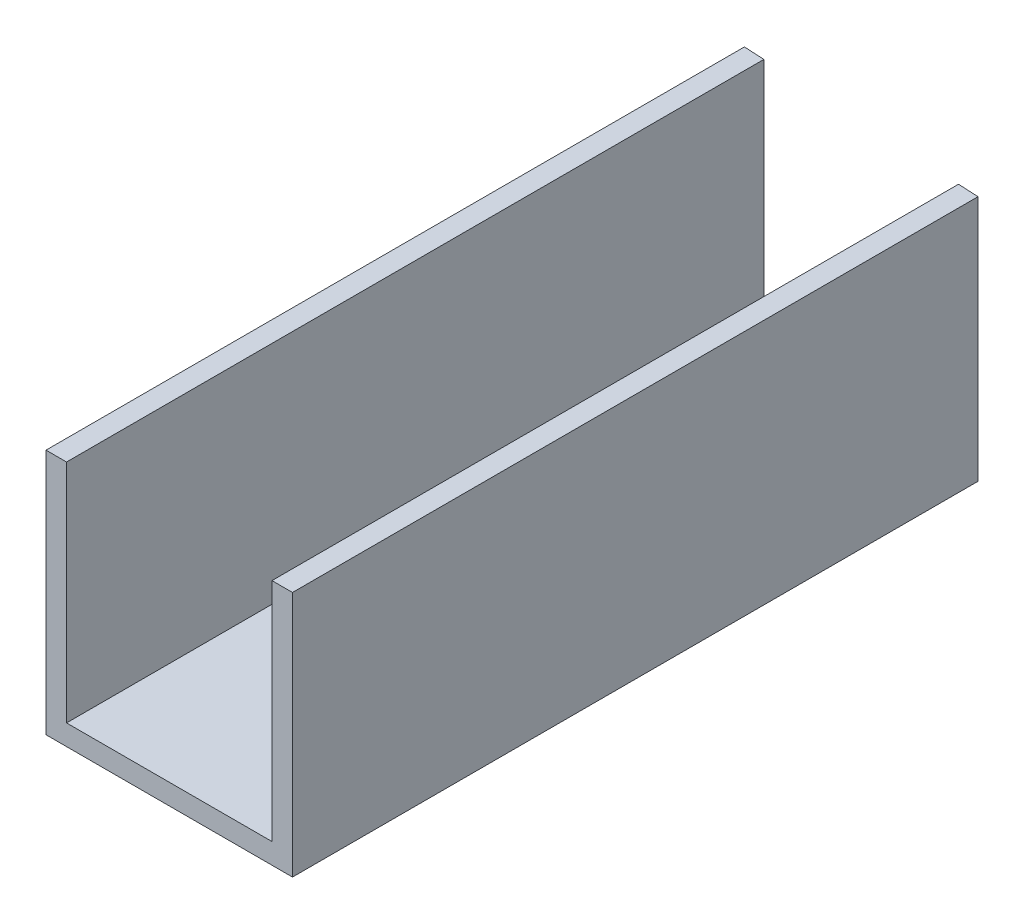
from build123d import *

# Parameters (mm, degrees)
BOSS_EXTRUDE1_DEPTH = 107.95
CUT_EXTRUDE1_DEPTH  = 98.425


with BuildPart() as part:
    # Sketch1 → Boss-Extrude1 (new body)
    with BuildSketch(Plane.XY):
        Polygon((18.371241491, 0), (-19.728758509, 0), (-19.728758509, 38.1), (-16.553758509, 38.1), (-16.553758509, 3.175), (15.196241491, 3.175), (15.196241491, 38.1), (18.371241491, 38.1), align=None)
    extrude(amount=BOSS_EXTRUDE1_DEPTH)

    # Sketch2 → Cut-Extrude1 (cut)
    with BuildSketch(Plane(origin=(0, 38.1, 0), x_dir=(1, 0, 0), z_dir=(0, 1, 0))):
        Polygon((-19.728758509, 0), (18.371241491, 0), (18.371241491, -1.996736391), align=None)
    extrude(amount=-CUT_EXTRUDE1_DEPTH, mode=Mode.SUBTRACT)


solid = part.part
